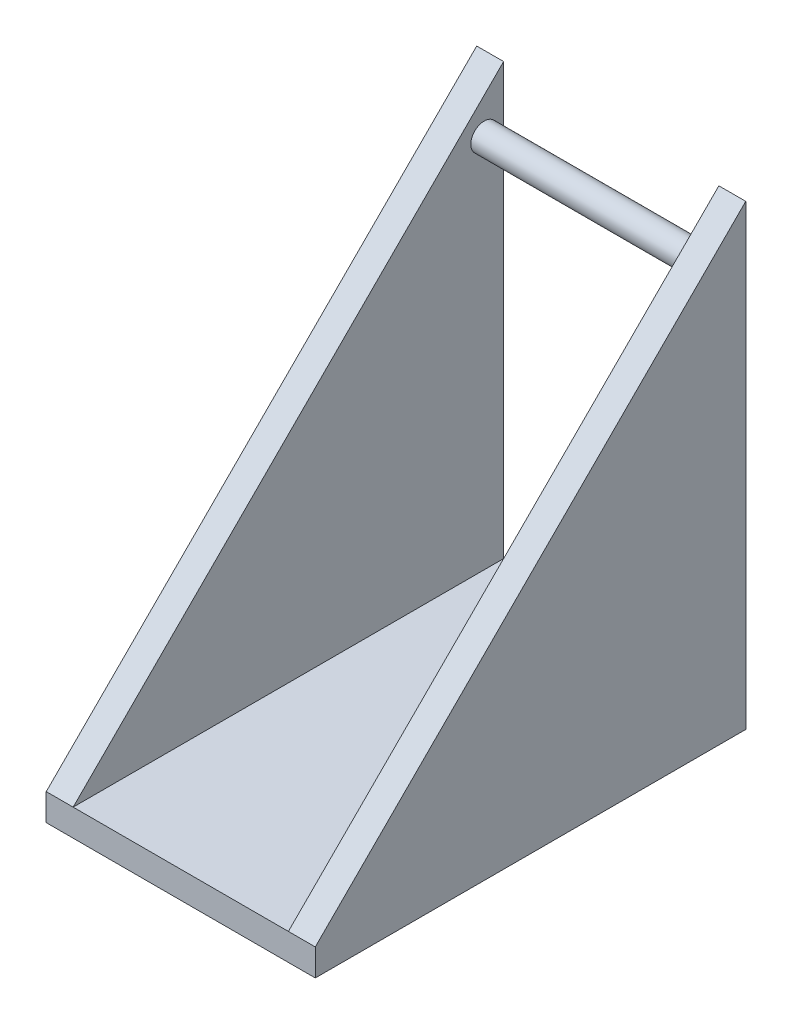
from build123d import *

# Parameters (mm, degrees)
SKETCH2_W           = 63.5
SKETCH2_H           = 6.35
BASE_DEPTH          = 101.6
RIB_DEPTH           = 6.35
BOSS_EXTRUDE4_REACH = 160.877
SKETCH5_R           = 3.175


with BuildPart() as part:
    # Sketch2 → Base (new body)
    with BuildSketch(Plane.XY):
        with Locations((31.75, 3.175)):
            Rectangle(SKETCH2_W, SKETCH2_H)
    extrude(amount=BASE_DEPTH)

    # Sketch4 → Rib (add)
    with BuildSketch(Plane(origin=(63.5, 0, 0), x_dir=(0, 0, -1), z_dir=(1, 0, 0))):
        Polygon((0, 107.95), (0, 6.35), (-101.6, 6.35), align=None)
    rib = extrude(amount=-RIB_DEPTH)

    # RibCopy: Rib across plane
    add(rib.mirror(Plane.ZY.offset(-31.75)))

    # Sketch5 → Boss-Extrude4 (add, up to next)
    with BuildSketch(Plane.ZY.offset(-57.15), mode=Mode.PRIVATE) as boss_extrude4_sk1:
        with Locations((4.574399673, 94.905637707)):
            Circle(SKETCH5_R)
    boss_extrude4_tool1 = extrude(boss_extrude4_sk1.sketch, amount=BOSS_EXTRUDE4_REACH, mode=Mode.PRIVATE) - part.part
    add(boss_extrude4_tool1.solids().sort_by_distance((57.15, 94.905638, 4.5744))[0])


solid = part.part
